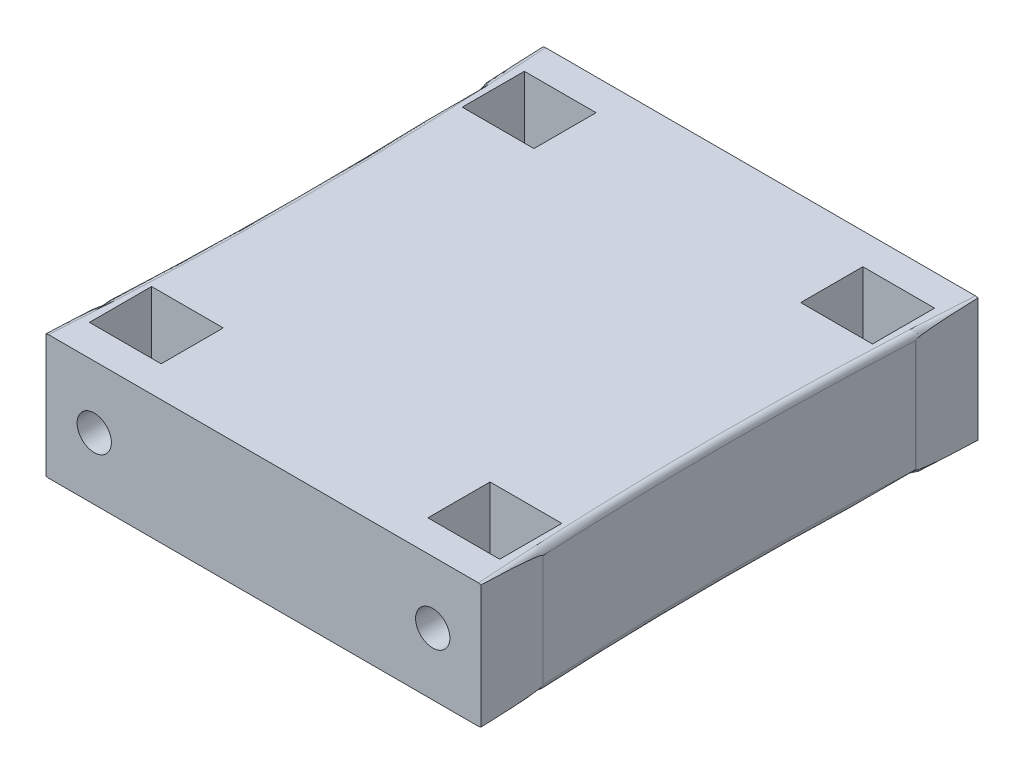
from build123d import *

# Parameters (mm, degrees)
SKETCH1_W           = 44.45
SKETCH1_H           = 12.7
SKETCH1_R           = 1.7526
BOSS_EXTRUDE1_DEPTH = 25.4
CUT_EXTRUDE1_START  = -3.175
CUT_EXTRUDE1_DEPTH  = 6.35
CUT_EXTRUDE2_START  = -47.625
CUT_EXTRUDE2_DEPTH  = 6.35
CUT_EXTRUDE3_DEPTH  = 53.74706153
FILLET1_ANGLE       = 7.76917
FILLET1_2_ANGLE     = 7.76917
FILLET1_3_ANGLE     = 7.76917
FILLET1_4_ANGLE     = 7.76917


with BuildPart() as part:
    # Sketch1 → Boss-Extrude1 (new, symmetric)
    with BuildSketch(Plane.XY):
        with Locations((22.225, 6.35)):
            Rectangle(SKETCH1_W, SKETCH1_H)
        with Locations((4.9276, 6.35)):
            Circle(SKETCH1_R, mode=Mode.SUBTRACT)
        with Locations((39.5224, 6.35)):
            Circle(SKETCH1_R, mode=Mode.SUBTRACT)
    extrude(amount=BOSS_EXTRUDE1_DEPTH, both=True)

    # Sketch2 → Cut-Extrude1 (cut)
    with BuildSketch(Plane.XY.offset(25.4).offset(CUT_EXTRUDE1_START)):
        Polygon((1.261425791, 6.35), (1.261425791, 14.915819411), (8.593774209, 14.915819411), (8.593774209, 6.35), (6.760687105, 3.175), (3.094512895, 3.175), align=None)
        Polygon((35.856225791, 6.35), (37.689312895, 3.175), (41.355487105, 3.175), (43.188574209, 6.35), (43.188574209, 16.066451869), (35.856225791, 16.066451869), align=None)
    extrude(amount=-CUT_EXTRUDE1_DEPTH, mode=Mode.SUBTRACT)

    # Sketch2<2> → Cut-Extrude2 (cut)
    with BuildSketch(Plane.XY.offset(25.4).offset(CUT_EXTRUDE2_START)):
        Polygon((1.261425791, 6.35), (1.261425791, 14.915819411), (8.593774209, 14.915819411), (8.593774209, 6.35), (6.760687105, 3.175), (3.094512895, 3.175), align=None)
        Polygon((35.856225791, 6.35), (37.689312895, 3.175), (41.355487105, 3.175), (43.188574209, 6.35), (43.188574209, 16.066451869), (35.856225791, 16.066451869), align=None)
    extrude(amount=CUT_EXTRUDE2_DEPTH, mode=Mode.SUBTRACT)

    # Sketch3 → Cut-Extrude3 (cut, through all)
    with BuildSketch(Plane.XZ):
        with BuildLine():
            Line((44.45, 19.05), (44.45, -19.05))
            ThreePointArc((44.45, -19.05), (43.965232978, 0), (44.45, 19.05))
        make_face()
        with BuildLine():
            Line((0, 19.05), (0, -19.05))
            ThreePointArc((0, -19.05), (0.484767022, 0), (0, 19.05))
        make_face()
    extrude(amount=-CUT_EXTRUDE3_DEPTH, mode=Mode.SUBTRACT)

    # Fillet1: read off the stored shape, not the designer's step
    # Fillet1 outline → Fillet1 (revolve, cut)
    with BuildSketch(Plane(origin=(418.513709618, 0, 0), x_dir=(-0.9977025418167154, 0, -0.0677468674734517), z_dir=(0.0677468674734517, 0, -0.9977025418167154))):
        with BuildLine():
            Line((374.54847664, 12.7), (374.54847664, 12.065))
            ThreePointArc((374.54847664, 12.065), (374.734463834, 12.514012806), (375.18347664, 12.7))
            Line((375.18347664, 12.7), (374.54847664, 12.7))
        make_face()
    revolve(axis=Axis((418.513709618, 0, 0), (0, 1, 0)), revolution_arc=FILLET1_ANGLE, mode=Mode.SUBTRACT)

    # Fillet1 2 outline → Fillet1 2 (revolve, cut)
    with BuildSketch(Plane(origin=(418.513709618, 0, 0), x_dir=(-0.9977025418167154, 0, -0.0677468674734517), z_dir=(0.0677468674734517, 0, -0.9977025418167154))):
        with BuildLine():
            ThreePointArc((375.18347664, 0), (374.734463834, 0.185987194), (374.54847664, 0.635))
            Line((374.54847664, 0.635), (374.54847664, 0))
            Line((374.54847664, 0), (375.18347664, 0))
        make_face()
    revolve(axis=Axis((418.513709618, 0, 0), (0, 1, 0)), revolution_arc=FILLET1_2_ANGLE, mode=Mode.SUBTRACT)

    # Fillet1 3 outline → Fillet1 3 (revolve, cut)
    with BuildSketch(Plane(origin=(-374.063709618, 0, 0), x_dir=(0.9977025418167152, 0, 0.06774686747345202), z_dir=(-0.06774686747345202, 0, 0.9977025418167152))):
        with BuildLine():
            Line((374.54847664, 12.7), (374.54847664, 12.065))
            ThreePointArc((374.54847664, 12.065), (374.734463834, 12.514012806), (375.18347664, 12.7))
            Line((375.18347664, 12.7), (374.54847664, 12.7))
        make_face()
    revolve(axis=Axis((-374.063709618, 0, 0), (0, 1, 0)), revolution_arc=FILLET1_3_ANGLE, mode=Mode.SUBTRACT)

    # Fillet1 4 outline → Fillet1 4 (revolve, cut)
    with BuildSketch(Plane(origin=(-374.063709618, 0, 0), x_dir=(0.9977025418167152, 0, 0.06774686747345202), z_dir=(-0.06774686747345202, 0, 0.9977025418167152))):
        with BuildLine():
            ThreePointArc((375.18347664, 0), (374.734463834, 0.185987194), (374.54847664, 0.635))
            Line((374.54847664, 0.635), (374.54847664, 0))
            Line((374.54847664, 0), (375.18347664, 0))
        make_face()
    revolve(axis=Axis((-374.063709618, 0, 0), (0, 1, 0)), revolution_arc=FILLET1_4_ANGLE, mode=Mode.SUBTRACT)


solid = part.part
